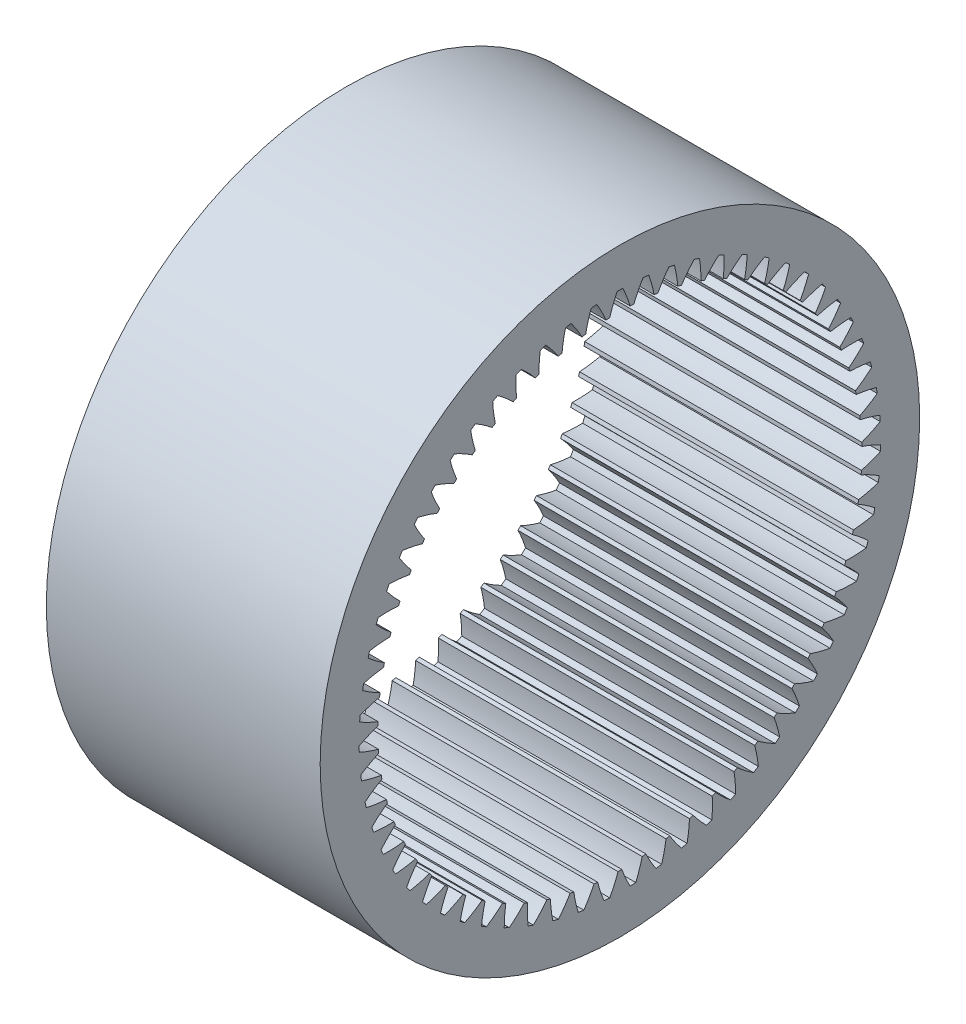
from build123d import *

# Parameters (mm, degrees)
BASPROSKE_W         = 32.815
BASPROSKE_H         = 2.2764
TOOTHCUT_DEPTH      = 56.074954552
TEETHCUTS_COUNT     = 63
SCALE1_SCALE        = 2
SKETCH2_R           = 72.5528
SKETCH2_R_2         = 62.5528
BOSS_EXTRUDE1_DEPTH = 65.63
SCALE2_SCALE        = 1.1
SCALE3_SCALE        = 1.01
SCALE4_SCALE        = 0.99009901
SCALE5_SCALE        = 0.909090909
SCALE6_SCALE        = 1.01
SKETCH3_R           = 73.278328
SKETCH3_R_2         = 72.5528
CUT_EXTRUDE1_DEPTH  = 124.017479557


with BuildPart() as part:
    # BasProSke → Base-Revolve (revolve)
    with BuildSketch(Plane(origin=(0, 0, 0), x_dir=(1, 0, 0), z_dir=(0, 1, 0))):
        with Locations((16.4075, 30.1382)):
            Rectangle(BASPROSKE_W, BASPROSKE_H)
    revolve(axis=Axis((-10, 0, 0), (1, 0, 0)))

    # TooCutSke → ToothCut (cut, through all)
    with BuildSketch(Plane(origin=(0, 0, 0), x_dir=(0, 0, -1), z_dir=(1, 0, 0))):
        with BuildLine():
            ThreePointArc((1.227357706, 28.948593027), (0.830805794, 30.117149174), (0.339543276, 31.24915537))
            ThreePointArc((0.339543276, 31.24915537), (0, 31.251), (-0.339543276, 31.24915537))
            ThreePointArc((-0.339543276, 31.24915537), (-0.830805794, 30.117149174), (-1.227357706, 28.948593027))
            ThreePointArc((-1.227357706, 28.948593027), (0, 28.9746), (1.227357706, 28.948593027))
        make_face()
    toothcut = extrude(amount=TOOTHCUT_DEPTH, mode=Mode.SUBTRACT)

    # TeethCuts: ToothCut ×63 about axis
    teethcuts_axis = Axis((-10, 0, 0), (1, 0, 0))
    for i in range(1, TEETHCUTS_COUNT):
        add(toothcut.rotate(teethcuts_axis, i * 360 / TEETHCUTS_COUNT), mode=Mode.SUBTRACT)


with BuildPart() as part_1:
    # Scale1: scaled about (16.4075, 0, 0)
    add(part.part.scale(SCALE1_SCALE).moved(Location((-16.4075, 0, 0))))

    # Sketch2 → Boss-Extrude1 (add)
    with BuildSketch(Plane(origin=(49.2225, 0, 0), x_dir=(0, 0, -1), z_dir=(1, 0, 0))):
        Circle(SKETCH2_R)
        Circle(SKETCH2_R_2, mode=Mode.SUBTRACT)
    extrude(amount=-BOSS_EXTRUDE1_DEPTH)


with BuildPart() as part_2:
    # Scale2: scaled about (16.4075, 0, 0)
    add(part_1.part.scale(SCALE2_SCALE).moved(Location((-1.64075, 0, 0))))


with BuildPart() as part_3:
    # Scale3: scaled about (16.4075, 0, 0)
    add(part_2.part.scale(SCALE3_SCALE).moved(Location((-0.164075, 0, 0))))


with BuildPart() as part_4:
    # Scale4: scaled about (16.4075, 0, 0)
    add(part_3.part.scale(SCALE4_SCALE).moved(Location((0.162450495, 0, 0))))


with BuildPart() as part_5:
    # Scale5: scaled about (16.4075, 0, 0)
    add(part_4.part.scale(SCALE5_SCALE).moved(Location((1.491590909, 0, 0))))


with BuildPart() as part_6:
    # Scale6: scaled about (16.4075, 0, 0)
    add(part_5.part.scale(SCALE6_SCALE).moved(Location((-0.164075, 0, 0))))

    # Sketch3 → Cut-Extrude1 (cut, through all)
    with BuildSketch(Plane.ZY.offset(16.73565)):
        Circle(SKETCH3_R)
        Circle(SKETCH3_R_2, mode=Mode.SUBTRACT)
    extrude(amount=-CUT_EXTRUDE1_DEPTH, mode=Mode.SUBTRACT)


solid = part_6.part
